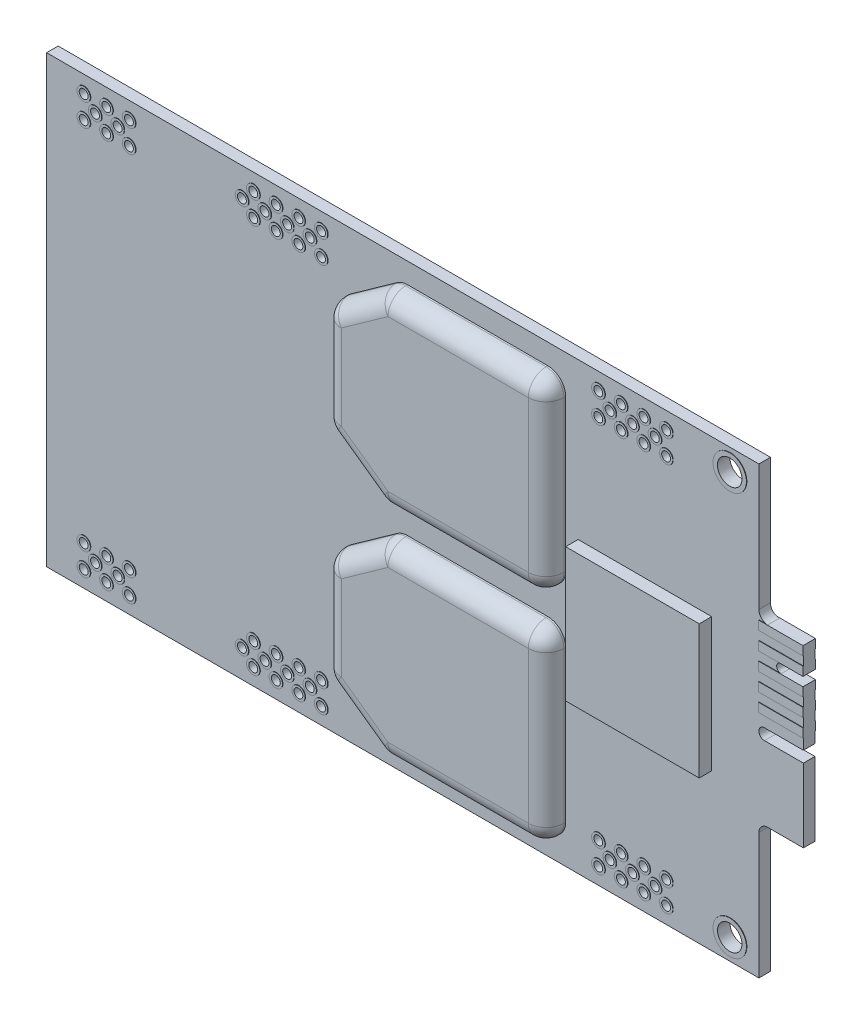
from build123d import *
from build123d.topology import SkipClean

# Parameters (mm, degrees)
SKETCH1_W             = 80
SKETCH1_H             = 50
BOSS_EXTRUDE1_DEPTH   = 1.3
BOSS_EXTRUDE2_DEPTH   = 2.2
BOSS_EXTRUDE2_2_DEPTH = 2.2
FILLET1_R             = 2
FILLET2_R             = 2
SKETCH3_W             = 15
SKETCH3_H             = 15
BOSS_EXTRUDE3_DEPTH   = 1.4
BOSS_EXTRUDE6_DEPTH   = 1.3
SKETCH5_W             = 4
SKETCH5_H             = 4
BOSS_EXTRUDE7_DEPTH   = 1
BOSS_EXTRUDE7_2_DEPTH = 1
BOSS_EXTRUDE7_3_DEPTH = 1
BOSS_EXTRUDE7_4_DEPTH = 1
BOSS_EXTRUDE7_5_DEPTH = 1
SKETCH6_R             = 0.5
CUT_EXTRUDE1_DEPTH    = 11
BOSS_EXTRUDE8_START   = 0.05
SKETCH7_R             = 0.75
SKETCH7_R_2           = 0.5
BOSS_EXTRUDE8_DEPTH   = 0.05
SKETCH8_R             = 0.75
SKETCH8_R_2           = 0.5
BOSS_EXTRUDE9_DEPTH   = 0.05
SKETCH9_W             = 5
SKETCH9_H             = 1
BOSS_EXTRUDE10_DEPTH  = 0.05
SKETCH10_W            = 5
SKETCH10_H            = 1
BOSS_EXTRUDE11_DEPTH  = 0.05
FILLET3_R             = 1
SKETCH12_R            = 1.375
CUT_EXTRUDE2_DEPTH    = 3.556
BOSS_EXTRUDE12_START  = 0.05
SKETCH13_R            = 1.875
SKETCH13_R_2          = 1.375
BOSS_EXTRUDE12_DEPTH  = 0.05
SKETCH14_R            = 1.875
SKETCH14_R_2          = 1.375
BOSS_EXTRUDE13_DEPTH  = 0.05


with BuildPart() as part:
    # Sketch1 → Boss-Extrude1 (new body)
    with BuildSketch(Plane.XY):
        with Locations((40, 25)):
            Rectangle(SKETCH1_W, SKETCH1_H)
    extrude(amount=BOSS_EXTRUDE1_DEPTH)

    # Sketch4 → Boss-Extrude6 (add)
    with BuildSketch(Plane.XY.offset(1.3)):
        with BuildLine():
            Line((80, 34.85), (85, 34.85))
            Line((85, 34.85), (85, 31.85))
            Line((85, 31.85), (82.5, 31.85))
            ThreePointArc((82.5, 31.85), (82, 31.35), (82.5, 30.85))
            Line((82.5, 30.85), (85, 30.85))
            Line((85, 30.85), (85, 24.65))
            Line((85, 24.65), (80.625, 24.65))
            ThreePointArc((80.625, 24.65), (80, 24.025), (80.625, 23.4))
            Line((80.625, 23.4), (85, 23.4))
            Line((85, 23.4), (85, 15.15))
            Line((85, 15.15), (80, 15.15))
            Line((80, 15.15), (78.715665538, 15.15))
            Line((78.715665538, 15.15), (78.715665538, 34.85))
            Line((78.715665538, 34.85), (80, 34.85))
        make_face()
    extrude(amount=-BOSS_EXTRUDE6_DEPTH)

    # Sketch6 → Cut-Extrude1 (cut)
    with BuildSketch(Plane.XY.offset(1.3)):
        with Locations((63.282, 46.85)):
            Circle(SKETCH6_R)
        with Locations((65.822, 46.85)):
            Circle(SKETCH6_R)
        with Locations((68.362, 46.85)):
            Circle(SKETCH6_R)
        with Locations((62.012, 48.12)):
            Circle(SKETCH6_R)
        with Locations((64.552, 48.12)):
            Circle(SKETCH6_R)
        with Locations((64.552, 45.58)):
            Circle(SKETCH6_R)
        with Locations((62.012, 45.58)):
            Circle(SKETCH6_R)
        with Locations(Location((67.092, 45.58, 0), (0, 0, 180))):
            Circle(SKETCH6_R)
        with Locations(Location((69.632, 45.58, 0), (0, 0, 180))):
            Circle(SKETCH6_R)
        with Locations(Location((69.632, 48.12, 0), (0, 0, 180))):
            Circle(SKETCH6_R)
        with Locations(Location((67.092, 48.12, 0), (0, 0, 180))):
            Circle(SKETCH6_R)
        with Locations((27.067, 46.85)):
            Circle(SKETCH6_R)
        with Locations((29.607, 46.85)):
            Circle(SKETCH6_R)
        with Locations((24.527, 46.85)):
            Circle(SKETCH6_R)
        with Locations((28.337, 45.58)):
            Circle(SKETCH6_R)
        with Locations((25.797, 45.58)):
            Circle(SKETCH6_R)
        with Locations((25.797, 48.12)):
            Circle(SKETCH6_R)
        with Locations((28.337, 48.12)):
            Circle(SKETCH6_R)
        with Locations((5.487, 46.85)):
            Circle(SKETCH6_R)
        with Locations((8.027, 46.85)):
            Circle(SKETCH6_R)
        with Locations((6.757, 45.58)):
            Circle(SKETCH6_R)
        with Locations((4.217, 45.58)):
            Circle(SKETCH6_R)
        with Locations((4.217, 48.12)):
            Circle(SKETCH6_R)
        with Locations((6.757, 48.12)):
            Circle(SKETCH6_R)
        with Locations(Location((9.297, 45.58, 0), (0, 0, 180))):
            Circle(SKETCH6_R)
        with Locations(Location((9.297, 48.12, 0), (0, 0, 180))):
            Circle(SKETCH6_R)
        with Locations(Location((63.282, 3.15, 0), (0, 0, 180))):
            Circle(SKETCH6_R)
        with Locations(Location((62.012, 1.88, 0), (0, 0, 180))):
            Circle(SKETCH6_R)
        with Locations(Location((64.552, 1.88, 0), (0, 0, 180))):
            Circle(SKETCH6_R)
        with Locations(Location((65.822, 3.15, 0), (0, 0, 180))):
            Circle(SKETCH6_R)
        with Locations((67.092, 1.88)):
            Circle(SKETCH6_R)
        with Locations((69.632, 1.88)):
            Circle(SKETCH6_R)
        with Locations(Location((68.362, 3.15, 0), (0, 0, 180))):
            Circle(SKETCH6_R)
        with Locations((69.632, 4.42)):
            Circle(SKETCH6_R)
        with Locations((67.092, 4.42)):
            Circle(SKETCH6_R)
        with Locations(Location((64.552, 4.42, 0), (0, 0, 180))):
            Circle(SKETCH6_R)
        with Locations(Location((62.012, 4.42, 0), (0, 0, 180))):
            Circle(SKETCH6_R)
        with Locations(Location((25.797, 4.42, 0), (0, 0, 180))):
            Circle(SKETCH6_R)
        with Locations(Location((28.337, 4.42, 0), (0, 0, 180))):
            Circle(SKETCH6_R)
        with Locations(Location((29.607, 3.15, 0), (0, 0, 180))):
            Circle(SKETCH6_R)
        with Locations(Location((27.067, 3.15, 0), (0, 0, 180))):
            Circle(SKETCH6_R)
        with Locations(Location((28.337, 1.88, 0), (0, 0, 180))):
            Circle(SKETCH6_R)
        with Locations(Location((25.797, 1.88, 0), (0, 0, 180))):
            Circle(SKETCH6_R)
        with Locations(Location((24.527, 3.15, 0), (0, 0, 180))):
            Circle(SKETCH6_R)
        with Locations((9.297, 4.42)):
            Circle(SKETCH6_R)
        with Locations((9.297, 1.88)):
            Circle(SKETCH6_R)
        with Locations(Location((6.757, 1.88, 0), (0, 0, 180))):
            Circle(SKETCH6_R)
        with Locations(Location((8.027, 3.15, 0), (0, 0, 180))):
            Circle(SKETCH6_R)
        with Locations(Location((6.757, 4.42, 0), (0, 0, 180))):
            Circle(SKETCH6_R)
        with Locations(Location((5.487, 3.15, 0), (0, 0, 180))):
            Circle(SKETCH6_R)
        with Locations(Location((4.217, 1.88, 0), (0, 0, 180))):
            Circle(SKETCH6_R)
        with Locations(Location((4.217, 4.42, 0), (0, 0, 180))):
            Circle(SKETCH6_R)
        with Locations(Location((30.877, 45.58, 0), (0, 0, 180))):
            Circle(SKETCH6_R)
        with Locations(Location((30.877, 48.12, 0), (0, 0, 180))):
            Circle(SKETCH6_R)
        with Locations(Location((23.257, 45.58, 0), (0, 0, 180))):
            Circle(SKETCH6_R)
        with Locations(Location((23.257, 48.12, 0), (0, 0, 180))):
            Circle(SKETCH6_R)
        with Locations((21.987, 46.85)):
            Circle(SKETCH6_R)
        with Locations((30.877, 1.88)):
            Circle(SKETCH6_R)
        with Locations((30.877, 4.42)):
            Circle(SKETCH6_R)
        with Locations((23.257, 1.88)):
            Circle(SKETCH6_R)
        with Locations(Location((21.987, 3.15, 0), (0, 0, 180))):
            Circle(SKETCH6_R)
        with Locations((23.257, 4.42)):
            Circle(SKETCH6_R)
    extrude(amount=-CUT_EXTRUDE1_DEPTH, mode=Mode.SUBTRACT)

    # Sketch7 → Boss-Extrude8 (add)
    # profile 1 of 62: a face of its own
    with BuildSketch(Plane.XY.offset(1.3).offset(BOSS_EXTRUDE8_START)):
        with Locations(Location((5.487, 46.85, 0), (0, 0, 180))):
            Circle(SKETCH7_R)
        with Locations((5.487, 46.85)):
            Circle(SKETCH7_R_2, mode=Mode.SUBTRACT)
    # profile 2 of 62: a face of its own
    with BuildSketch(Plane.XY.offset(1.3).offset(BOSS_EXTRUDE8_START)):
        with Locations(Location((8.027, 46.85, 0), (0, 0, 180))):
            Circle(SKETCH7_R)
        with Locations((8.027, 46.85)):
            Circle(SKETCH7_R_2, mode=Mode.SUBTRACT)
    # profile 3 of 62: a face of its own
    with BuildSketch(Plane.XY.offset(1.3).offset(BOSS_EXTRUDE8_START)):
        with Locations(Location((6.757, 45.58, 0), (0, 0, 180))):
            Circle(SKETCH7_R)
        with Locations((6.757, 45.58)):
            Circle(SKETCH7_R_2, mode=Mode.SUBTRACT)
    # profile 4 of 62: a face of its own
    with BuildSketch(Plane.XY.offset(1.3).offset(BOSS_EXTRUDE8_START)):
        with Locations(Location((9.297, 45.58, 0), (0, 0, 180))):
            Circle(SKETCH7_R)
        with Locations((9.297, 45.58)):
            Circle(SKETCH7_R_2, mode=Mode.SUBTRACT)
    # profile 5 of 62: a face of its own
    with BuildSketch(Plane.XY.offset(1.3).offset(BOSS_EXTRUDE8_START)):
        with Locations(Location((25.797, 48.12, 0), (0, 0, 180))):
            Circle(SKETCH7_R)
        with Locations((25.797, 48.12)):
            Circle(SKETCH7_R_2, mode=Mode.SUBTRACT)
    # profile 6 of 62: a face of its own
    with BuildSketch(Plane.XY.offset(1.3).offset(BOSS_EXTRUDE8_START)):
        with Locations(Location((24.527, 46.85, 0), (0, 0, 180))):
            Circle(SKETCH7_R)
        with Locations((24.527, 46.85)):
            Circle(SKETCH7_R_2, mode=Mode.SUBTRACT)
    # profile 7 of 62: a face of its own
    with BuildSketch(Plane.XY.offset(1.3).offset(BOSS_EXTRUDE8_START)):
        with Locations(Location((27.067, 46.85, 0), (0, 0, 180))):
            Circle(SKETCH7_R)
        with Locations((27.067, 46.85)):
            Circle(SKETCH7_R_2, mode=Mode.SUBTRACT)
    # profile 8 of 62: a face of its own
    with BuildSketch(Plane.XY.offset(1.3).offset(BOSS_EXTRUDE8_START)):
        with Locations(Location((28.337, 48.12, 0), (0, 0, 180))):
            Circle(SKETCH7_R)
        with Locations((28.337, 48.12)):
            Circle(SKETCH7_R_2, mode=Mode.SUBTRACT)
    # profile 9 of 62: a face of its own
    with BuildSketch(Plane.XY.offset(1.3).offset(BOSS_EXTRUDE8_START)):
        with Locations(Location((29.607, 46.85, 0), (0, 0, 180))):
            Circle(SKETCH7_R)
        with Locations((29.607, 46.85)):
            Circle(SKETCH7_R_2, mode=Mode.SUBTRACT)
    # profile 10 of 62: a face of its own
    with BuildSketch(Plane.XY.offset(1.3).offset(BOSS_EXTRUDE8_START)):
        with Locations(Location((25.797, 45.58, 0), (0, 0, 180))):
            Circle(SKETCH7_R)
        with Locations((25.797, 45.58)):
            Circle(SKETCH7_R_2, mode=Mode.SUBTRACT)
    # profile 11 of 62: a face of its own
    with BuildSketch(Plane.XY.offset(1.3).offset(BOSS_EXTRUDE8_START)):
        with Locations(Location((28.337, 45.58, 0), (0, 0, 180))):
            Circle(SKETCH7_R)
        with Locations((28.337, 45.58)):
            Circle(SKETCH7_R_2, mode=Mode.SUBTRACT)
    # profile 12 of 62: a face of its own
    with BuildSketch(Plane.XY.offset(1.3).offset(BOSS_EXTRUDE8_START)):
        with Locations(Location((62.012, 48.12, 0), (0, 0, 180))):
            Circle(SKETCH7_R)
        with Locations((62.012, 48.12)):
            Circle(SKETCH7_R_2, mode=Mode.SUBTRACT)
    # profile 13 of 62: a face of its own
    with BuildSketch(Plane.XY.offset(1.3).offset(BOSS_EXTRUDE8_START)):
        with Locations(Location((64.552, 48.12, 0), (0, 0, 180))):
            Circle(SKETCH7_R)
        with Locations((64.552, 48.12)):
            Circle(SKETCH7_R_2, mode=Mode.SUBTRACT)
    # profile 14 of 62: a face of its own
    with BuildSketch(Plane.XY.offset(1.3).offset(BOSS_EXTRUDE8_START)):
        with Locations(Location((67.092, 48.12, 0), (0, 0, 180))):
            Circle(SKETCH7_R)
        with Locations((67.092, 48.12)):
            Circle(SKETCH7_R_2, mode=Mode.SUBTRACT)
    # profile 15 of 62: a face of its own
    with BuildSketch(Plane.XY.offset(1.3).offset(BOSS_EXTRUDE8_START)):
        with Locations(Location((69.632, 48.12, 0), (0, 0, 180))):
            Circle(SKETCH7_R)
        with Locations((69.632, 48.12)):
            Circle(SKETCH7_R_2, mode=Mode.SUBTRACT)
    # profile 16 of 62: a face of its own
    with BuildSketch(Plane.XY.offset(1.3).offset(BOSS_EXTRUDE8_START)):
        with Locations(Location((62.012, 45.58, 0), (0, 0, 180))):
            Circle(SKETCH7_R)
        with Locations((62.012, 45.58)):
            Circle(SKETCH7_R_2, mode=Mode.SUBTRACT)
    # profile 17 of 62: a face of its own
    with BuildSketch(Plane.XY.offset(1.3).offset(BOSS_EXTRUDE8_START)):
        with Locations(Location((4.217, 48.12, 0), (0, 0, 180))):
            Circle(SKETCH7_R)
        with Locations((4.217, 48.12)):
            Circle(SKETCH7_R_2, mode=Mode.SUBTRACT)
    # profile 18 of 62: a face of its own
    with BuildSketch(Plane.XY.offset(1.3).offset(BOSS_EXTRUDE8_START)):
        with Locations(Location((6.757, 48.12, 0), (0, 0, 180))):
            Circle(SKETCH7_R)
        with Locations((6.757, 48.12)):
            Circle(SKETCH7_R_2, mode=Mode.SUBTRACT)
    # profile 19 of 62: a face of its own
    with BuildSketch(Plane.XY.offset(1.3).offset(BOSS_EXTRUDE8_START)):
        with Locations(Location((63.282, 46.85, 0), (0, 0, 180))):
            Circle(SKETCH7_R)
        with Locations((63.282, 46.85)):
            Circle(SKETCH7_R_2, mode=Mode.SUBTRACT)
    # profile 20 of 62: a face of its own
    with BuildSketch(Plane.XY.offset(1.3).offset(BOSS_EXTRUDE8_START)):
        with Locations(Location((9.297, 48.12, 0), (0, 0, 180))):
            Circle(SKETCH7_R)
        with Locations((9.297, 48.12)):
            Circle(SKETCH7_R_2, mode=Mode.SUBTRACT)
    # profile 21 of 62: a face of its own
    with BuildSketch(Plane.XY.offset(1.3).offset(BOSS_EXTRUDE8_START)):
        with Locations(Location((4.217, 45.58, 0), (0, 0, 180))):
            Circle(SKETCH7_R)
        with Locations((4.217, 45.58)):
            Circle(SKETCH7_R_2, mode=Mode.SUBTRACT)
    # profile 22 of 62: a face of its own
    with BuildSketch(Plane.XY.offset(1.3).offset(BOSS_EXTRUDE8_START)):
        with Locations(Location((65.822, 46.85, 0), (0, 0, 180))):
            Circle(SKETCH7_R)
        with Locations((65.822, 46.85)):
            Circle(SKETCH7_R_2, mode=Mode.SUBTRACT)
    # profile 23 of 62: a face of its own
    with BuildSketch(Plane.XY.offset(1.3).offset(BOSS_EXTRUDE8_START)):
        with Locations(Location((68.362, 46.85, 0), (0, 0, 180))):
            Circle(SKETCH7_R)
        with Locations((68.362, 46.85)):
            Circle(SKETCH7_R_2, mode=Mode.SUBTRACT)
    # profile 24 of 62: a face of its own
    with BuildSketch(Plane.XY.offset(1.3).offset(BOSS_EXTRUDE8_START)):
        with Locations(Location((69.632, 45.58, 0), (0, 0, 180))):
            Circle(SKETCH7_R)
        with Locations((69.632, 45.58)):
            Circle(SKETCH7_R_2, mode=Mode.SUBTRACT)
    # profile 25 of 62: a face of its own
    with BuildSketch(Plane.XY.offset(1.3).offset(BOSS_EXTRUDE8_START)):
        with Locations(Location((67.092, 45.58, 0), (0, 0, 180))):
            Circle(SKETCH7_R)
        with Locations((67.092, 45.58)):
            Circle(SKETCH7_R_2, mode=Mode.SUBTRACT)
    # profile 26 of 62: a face of its own
    with BuildSketch(Plane.XY.offset(1.3).offset(BOSS_EXTRUDE8_START)):
        with Locations(Location((64.552, 45.58, 0), (0, 0, 180))):
            Circle(SKETCH7_R)
        with Locations((64.552, 45.58)):
            Circle(SKETCH7_R_2, mode=Mode.SUBTRACT)
    # profile 27 of 62: a face of its own
    with BuildSketch(Plane.XY.offset(1.3).offset(BOSS_EXTRUDE8_START)):
        with Locations(Location((69.632, 4.42, 0), (0, 0, 180))):
            Circle(SKETCH7_R)
        with Locations((69.632, 4.42)):
            Circle(SKETCH7_R_2, mode=Mode.SUBTRACT)
    # profile 28 of 62: a face of its own
    with BuildSketch(Plane.XY.offset(1.3).offset(BOSS_EXTRUDE8_START)):
        with Locations(Location((67.092, 4.42, 0), (0, 0, 180))):
            Circle(SKETCH7_R)
        with Locations((67.092, 4.42)):
            Circle(SKETCH7_R_2, mode=Mode.SUBTRACT)
    # profile 29 of 62: a face of its own
    with BuildSketch(Plane.XY.offset(1.3).offset(BOSS_EXTRUDE8_START)):
        with Locations(Location((64.552, 4.42, 0), (0, 0, 180))):
            Circle(SKETCH7_R)
        with Locations((64.552, 4.42)):
            Circle(SKETCH7_R_2, mode=Mode.SUBTRACT)
    # profile 30 of 62: a face of its own
    with BuildSketch(Plane.XY.offset(1.3).offset(BOSS_EXTRUDE8_START)):
        with Locations(Location((62.012, 4.42, 0), (0, 0, 180))):
            Circle(SKETCH7_R)
        with Locations((62.012, 4.42)):
            Circle(SKETCH7_R_2, mode=Mode.SUBTRACT)
    # profile 31 of 62: a face of its own
    with BuildSketch(Plane.XY.offset(1.3).offset(BOSS_EXTRUDE8_START)):
        with Locations(Location((62.012, 1.88, 0), (0, 0, 180))):
            Circle(SKETCH7_R)
        with Locations((62.012, 1.88)):
            Circle(SKETCH7_R_2, mode=Mode.SUBTRACT)
    # profile 32 of 62: a face of its own
    with BuildSketch(Plane.XY.offset(1.3).offset(BOSS_EXTRUDE8_START)):
        with Locations(Location((63.282, 3.15, 0), (0, 0, 180))):
            Circle(SKETCH7_R)
        with Locations((63.282, 3.15)):
            Circle(SKETCH7_R_2, mode=Mode.SUBTRACT)
    # profile 33 of 62: a face of its own
    with BuildSketch(Plane.XY.offset(1.3).offset(BOSS_EXTRUDE8_START)):
        with Locations(Location((64.552, 1.88, 0), (0, 0, 180))):
            Circle(SKETCH7_R)
        with Locations((64.552, 1.88)):
            Circle(SKETCH7_R_2, mode=Mode.SUBTRACT)
    # profile 34 of 62: a face of its own
    with BuildSketch(Plane.XY.offset(1.3).offset(BOSS_EXTRUDE8_START)):
        with Locations(Location((65.822, 3.15, 0), (0, 0, 180))):
            Circle(SKETCH7_R)
        with Locations((65.822, 3.15)):
            Circle(SKETCH7_R_2, mode=Mode.SUBTRACT)
    # profile 35 of 62: a face of its own
    with BuildSketch(Plane.XY.offset(1.3).offset(BOSS_EXTRUDE8_START)):
        with Locations(Location((67.092, 1.88, 0), (0, 0, 180))):
            Circle(SKETCH7_R)
        with Locations((67.092, 1.88)):
            Circle(SKETCH7_R_2, mode=Mode.SUBTRACT)
    # profile 36 of 62: a face of its own
    with BuildSketch(Plane.XY.offset(1.3).offset(BOSS_EXTRUDE8_START)):
        with Locations(Location((68.362, 3.15, 0), (0, 0, 180))):
            Circle(SKETCH7_R)
        with Locations((68.362, 3.15)):
            Circle(SKETCH7_R_2, mode=Mode.SUBTRACT)
    # profile 37 of 62: a face of its own
    with BuildSketch(Plane.XY.offset(1.3).offset(BOSS_EXTRUDE8_START)):
        with Locations(Location((69.632, 1.88, 0), (0, 0, 180))):
            Circle(SKETCH7_R)
        with Locations((69.632, 1.88)):
            Circle(SKETCH7_R_2, mode=Mode.SUBTRACT)
    # profile 38 of 62: a face of its own
    with BuildSketch(Plane.XY.offset(1.3).offset(BOSS_EXTRUDE8_START)):
        with Locations(Location((29.607, 3.15, 0), (0, 0, 180))):
            Circle(SKETCH7_R)
        with Locations((29.607, 3.15)):
            Circle(SKETCH7_R_2, mode=Mode.SUBTRACT)
    # profile 39 of 62: a face of its own
    with BuildSketch(Plane.XY.offset(1.3).offset(BOSS_EXTRUDE8_START)):
        with Locations(Location((28.337, 4.42, 0), (0, 0, 180))):
            Circle(SKETCH7_R)
        with Locations((28.337, 4.42)):
            Circle(SKETCH7_R_2, mode=Mode.SUBTRACT)
    # profile 40 of 62: a face of its own
    with BuildSketch(Plane.XY.offset(1.3).offset(BOSS_EXTRUDE8_START)):
        with Locations(Location((25.797, 4.42, 0), (0, 0, 180))):
            Circle(SKETCH7_R)
        with Locations((25.797, 4.42)):
            Circle(SKETCH7_R_2, mode=Mode.SUBTRACT)
    # profile 41 of 62: a face of its own
    with BuildSketch(Plane.XY.offset(1.3).offset(BOSS_EXTRUDE8_START)):
        with Locations(Location((24.527, 3.15, 0), (0, 0, 180))):
            Circle(SKETCH7_R)
        with Locations((24.527, 3.15)):
            Circle(SKETCH7_R_2, mode=Mode.SUBTRACT)
    # profile 42 of 62: a face of its own
    with BuildSketch(Plane.XY.offset(1.3).offset(BOSS_EXTRUDE8_START)):
        with Locations(Location((27.067, 3.15, 0), (0, 0, 180))):
            Circle(SKETCH7_R)
        with Locations((27.067, 3.15)):
            Circle(SKETCH7_R_2, mode=Mode.SUBTRACT)
    # profile 43 of 62: a face of its own
    with BuildSketch(Plane.XY.offset(1.3).offset(BOSS_EXTRUDE8_START)):
        with Locations(Location((25.797, 1.88, 0), (0, 0, 180))):
            Circle(SKETCH7_R)
        with Locations((25.797, 1.88)):
            Circle(SKETCH7_R_2, mode=Mode.SUBTRACT)
    # profile 44 of 62: a face of its own
    with BuildSketch(Plane.XY.offset(1.3).offset(BOSS_EXTRUDE8_START)):
        with Locations(Location((28.337, 1.88, 0), (0, 0, 180))):
            Circle(SKETCH7_R)
        with Locations((28.337, 1.88)):
            Circle(SKETCH7_R_2, mode=Mode.SUBTRACT)
    # profile 45 of 62: a face of its own
    with BuildSketch(Plane.XY.offset(1.3).offset(BOSS_EXTRUDE8_START)):
        with Locations(Location((4.217, 4.42, 0), (0, 0, 180))):
            Circle(SKETCH7_R)
        with Locations((4.217, 4.42)):
            Circle(SKETCH7_R_2, mode=Mode.SUBTRACT)
    # profile 46 of 62: a face of its own
    with BuildSketch(Plane.XY.offset(1.3).offset(BOSS_EXTRUDE8_START)):
        with Locations(Location((6.757, 4.42, 0), (0, 0, 180))):
            Circle(SKETCH7_R)
        with Locations((6.757, 4.42)):
            Circle(SKETCH7_R_2, mode=Mode.SUBTRACT)
    # profile 47 of 62: a face of its own
    with BuildSketch(Plane.XY.offset(1.3).offset(BOSS_EXTRUDE8_START)):
        with Locations(Location((9.297, 4.42, 0), (0, 0, 180))):
            Circle(SKETCH7_R)
        with Locations((9.297, 4.42)):
            Circle(SKETCH7_R_2, mode=Mode.SUBTRACT)
    # profile 48 of 62: a face of its own
    with BuildSketch(Plane.XY.offset(1.3).offset(BOSS_EXTRUDE8_START)):
        with Locations(Location((5.487, 3.15, 0), (0, 0, 180))):
            Circle(SKETCH7_R)
        with Locations((5.487, 3.15)):
            Circle(SKETCH7_R_2, mode=Mode.SUBTRACT)
    # profile 49 of 62: a face of its own
    with BuildSketch(Plane.XY.offset(1.3).offset(BOSS_EXTRUDE8_START)):
        with Locations(Location((8.027, 3.15, 0), (0, 0, 180))):
            Circle(SKETCH7_R)
        with Locations((8.027, 3.15)):
            Circle(SKETCH7_R_2, mode=Mode.SUBTRACT)
    # profile 50 of 62: a face of its own
    with BuildSketch(Plane.XY.offset(1.3).offset(BOSS_EXTRUDE8_START)):
        with Locations(Location((4.217, 1.88, 0), (0, 0, 180))):
            Circle(SKETCH7_R)
        with Locations((4.217, 1.88)):
            Circle(SKETCH7_R_2, mode=Mode.SUBTRACT)
    # profile 51 of 62: a face of its own
    with BuildSketch(Plane.XY.offset(1.3).offset(BOSS_EXTRUDE8_START)):
        with Locations(Location((6.757, 1.88, 0), (0, 0, 180))):
            Circle(SKETCH7_R)
        with Locations((6.757, 1.88)):
            Circle(SKETCH7_R_2, mode=Mode.SUBTRACT)
    # profile 52 of 62: a face of its own
    with BuildSketch(Plane.XY.offset(1.3).offset(BOSS_EXTRUDE8_START)):
        with Locations(Location((9.297, 1.88, 0), (0, 0, 180))):
            Circle(SKETCH7_R)
        with Locations((9.297, 1.88)):
            Circle(SKETCH7_R_2, mode=Mode.SUBTRACT)
    # profile 53 of 62: a face of its own
    with BuildSketch(Plane.XY.offset(1.3).offset(BOSS_EXTRUDE8_START)):
        with Locations(Location((23.257, 48.12, 0), (0, 0, 180))):
            Circle(SKETCH7_R)
        with Locations((23.257, 48.12)):
            Circle(SKETCH7_R_2, mode=Mode.SUBTRACT)
    # profile 54 of 62: a face of its own
    with BuildSketch(Plane.XY.offset(1.3).offset(BOSS_EXTRUDE8_START)):
        with Locations(Location((21.987, 46.85, 0), (0, 0, 180))):
            Circle(SKETCH7_R)
        with Locations((21.987, 46.85)):
            Circle(SKETCH7_R_2, mode=Mode.SUBTRACT)
    # profile 55 of 62: a face of its own
    with BuildSketch(Plane.XY.offset(1.3).offset(BOSS_EXTRUDE8_START)):
        with Locations(Location((23.257, 45.58, 0), (0, 0, 180))):
            Circle(SKETCH7_R)
        with Locations((23.257, 45.58)):
            Circle(SKETCH7_R_2, mode=Mode.SUBTRACT)
    # profile 56 of 62: a face of its own
    with BuildSketch(Plane.XY.offset(1.3).offset(BOSS_EXTRUDE8_START)):
        with Locations(Location((30.877, 48.12, 0), (0, 0, 180))):
            Circle(SKETCH7_R)
        with Locations((30.877, 48.12)):
            Circle(SKETCH7_R_2, mode=Mode.SUBTRACT)
    # profile 57 of 62: a face of its own
    with BuildSketch(Plane.XY.offset(1.3).offset(BOSS_EXTRUDE8_START)):
        with Locations(Location((30.877, 45.58, 0), (0, 0, 180))):
            Circle(SKETCH7_R)
        with Locations((30.877, 45.58)):
            Circle(SKETCH7_R_2, mode=Mode.SUBTRACT)
    # profile 58 of 62: a face of its own
    with BuildSketch(Plane.XY.offset(1.3).offset(BOSS_EXTRUDE8_START)):
        with Locations(Location((23.257, 4.42, 0), (0, 0, 180))):
            Circle(SKETCH7_R)
        with Locations((23.257, 4.42)):
            Circle(SKETCH7_R_2, mode=Mode.SUBTRACT)
    # profile 59 of 62: a face of its own
    with BuildSketch(Plane.XY.offset(1.3).offset(BOSS_EXTRUDE8_START)):
        with Locations(Location((21.987, 3.15, 0), (0, 0, 180))):
            Circle(SKETCH7_R)
        with Locations((21.987, 3.15)):
            Circle(SKETCH7_R_2, mode=Mode.SUBTRACT)
    # profile 60 of 62: a face of its own
    with BuildSketch(Plane.XY.offset(1.3).offset(BOSS_EXTRUDE8_START)):
        with Locations(Location((23.257, 1.88, 0), (0, 0, 180))):
            Circle(SKETCH7_R)
        with Locations((23.257, 1.88)):
            Circle(SKETCH7_R_2, mode=Mode.SUBTRACT)
    # profile 61 of 62: a face of its own
    with BuildSketch(Plane.XY.offset(1.3).offset(BOSS_EXTRUDE8_START)):
        with Locations(Location((30.877, 4.42, 0), (0, 0, 180))):
            Circle(SKETCH7_R)
        with Locations((30.877, 4.42)):
            Circle(SKETCH7_R_2, mode=Mode.SUBTRACT)
    # profile 62 of 62: a face of its own
    with BuildSketch(Plane.XY.offset(1.3).offset(BOSS_EXTRUDE8_START)):
        with Locations(Location((30.877, 1.88, 0), (0, 0, 180))):
            Circle(SKETCH7_R)
        with Locations((30.877, 1.88)):
            Circle(SKETCH7_R_2, mode=Mode.SUBTRACT)
    extrude(amount=-BOSS_EXTRUDE8_DEPTH)

    # Sketch8 → Boss-Extrude9 (add)
    # profile 1 of 62: a face of its own
    with SkipClean():  # the faces are left unmerged after this step: merging them gives an invalid solid
        with BuildSketch(Plane(origin=(0, 0, 0), x_dir=(-1, 0, 0), z_dir=(0, 0, -1))):
            with Locations((-9.297, 48.12)):
                Circle(SKETCH8_R)
            with Locations(Location((-9.297, 48.12, 0), (0, 0, 180))):
                Circle(SKETCH8_R_2, mode=Mode.SUBTRACT)
        # profile 2 of 62: a face of its own
        with BuildSketch(Plane(origin=(0, 0, 0), x_dir=(-1, 0, 0), z_dir=(0, 0, -1))):
            with Locations((-6.757, 48.12)):
                Circle(SKETCH8_R)
            with Locations(Location((-6.757, 48.12, 0), (0, 0, 180))):
                Circle(SKETCH8_R_2, mode=Mode.SUBTRACT)
        # profile 3 of 62: a face of its own
        with BuildSketch(Plane(origin=(0, 0, 0), x_dir=(-1, 0, 0), z_dir=(0, 0, -1))):
            with Locations((-5.487, 46.85)):
                Circle(SKETCH8_R)
            with Locations(Location((-5.487, 46.85, 0), (0, 0, 180))):
                Circle(SKETCH8_R_2, mode=Mode.SUBTRACT)
        # profile 4 of 62: a face of its own
        with BuildSketch(Plane(origin=(0, 0, 0), x_dir=(-1, 0, 0), z_dir=(0, 0, -1))):
            with Locations((-4.217, 45.58)):
                Circle(SKETCH8_R)
            with Locations(Location((-4.217, 45.58, 0), (0, 0, 180))):
                Circle(SKETCH8_R_2, mode=Mode.SUBTRACT)
        # profile 5 of 62: a face of its own
        with BuildSketch(Plane(origin=(0, 0, 0), x_dir=(-1, 0, 0), z_dir=(0, 0, -1))):
            with Locations((-24.527, 46.85)):
                Circle(SKETCH8_R)
            with Locations(Location((-24.527, 46.85, 0), (0, 0, 180))):
                Circle(SKETCH8_R_2, mode=Mode.SUBTRACT)
        # profile 6 of 62: a face of its own
        with BuildSketch(Plane(origin=(0, 0, 0), x_dir=(-1, 0, 0), z_dir=(0, 0, -1))):
            with Locations((-25.797, 48.12)):
                Circle(SKETCH8_R)
            with Locations(Location((-25.797, 48.12, 0), (0, 0, 180))):
                Circle(SKETCH8_R_2, mode=Mode.SUBTRACT)
        # profile 7 of 62: a face of its own
        with BuildSketch(Plane(origin=(0, 0, 0), x_dir=(-1, 0, 0), z_dir=(0, 0, -1))):
            with Locations((-9.297, 45.58)):
                Circle(SKETCH8_R)
            with Locations(Location((-9.297, 45.58, 0), (0, 0, 180))):
                Circle(SKETCH8_R_2, mode=Mode.SUBTRACT)
        # profile 8 of 62: a face of its own
        with BuildSketch(Plane(origin=(0, 0, 0), x_dir=(-1, 0, 0), z_dir=(0, 0, -1))):
            with Locations((-6.757, 45.58)):
                Circle(SKETCH8_R)
            with Locations(Location((-6.757, 45.58, 0), (0, 0, 180))):
                Circle(SKETCH8_R_2, mode=Mode.SUBTRACT)
        # profile 9 of 62: a face of its own
        with BuildSketch(Plane(origin=(0, 0, 0), x_dir=(-1, 0, 0), z_dir=(0, 0, -1))):
            with Locations((-8.027, 46.85)):
                Circle(SKETCH8_R)
            with Locations(Location((-8.027, 46.85, 0), (0, 0, 180))):
                Circle(SKETCH8_R_2, mode=Mode.SUBTRACT)
        # profile 10 of 62: a face of its own
        with BuildSketch(Plane(origin=(0, 0, 0), x_dir=(-1, 0, 0), z_dir=(0, 0, -1))):
            with Locations((-28.337, 45.58)):
                Circle(SKETCH8_R)
            with Locations(Location((-28.337, 45.58, 0), (0, 0, 180))):
                Circle(SKETCH8_R_2, mode=Mode.SUBTRACT)
        # profile 11 of 62: a face of its own
        with BuildSketch(Plane(origin=(0, 0, 0), x_dir=(-1, 0, 0), z_dir=(0, 0, -1))):
            with Locations((-25.797, 45.58)):
                Circle(SKETCH8_R)
            with Locations(Location((-25.797, 45.58, 0), (0, 0, 180))):
                Circle(SKETCH8_R_2, mode=Mode.SUBTRACT)
        # profile 12 of 62: a face of its own
        with BuildSketch(Plane(origin=(0, 0, 0), x_dir=(-1, 0, 0), z_dir=(0, 0, -1))):
            with Locations((-29.607, 46.85)):
                Circle(SKETCH8_R)
            with Locations(Location((-29.607, 46.85, 0), (0, 0, 180))):
                Circle(SKETCH8_R_2, mode=Mode.SUBTRACT)
        # profile 13 of 62: a face of its own
        with BuildSketch(Plane(origin=(0, 0, 0), x_dir=(-1, 0, 0), z_dir=(0, 0, -1))):
            with Locations((-28.337, 48.12)):
                Circle(SKETCH8_R)
            with Locations(Location((-28.337, 48.12, 0), (0, 0, 180))):
                Circle(SKETCH8_R_2, mode=Mode.SUBTRACT)
        # profile 14 of 62: a face of its own
        with BuildSketch(Plane(origin=(0, 0, 0), x_dir=(-1, 0, 0), z_dir=(0, 0, -1))):
            with Locations((-27.067, 46.85)):
                Circle(SKETCH8_R)
            with Locations(Location((-27.067, 46.85, 0), (0, 0, 180))):
                Circle(SKETCH8_R_2, mode=Mode.SUBTRACT)
        # profile 15 of 62: a face of its own
        with BuildSketch(Plane(origin=(0, 0, 0), x_dir=(-1, 0, 0), z_dir=(0, 0, -1))):
            with Locations((-63.282, 46.85)):
                Circle(SKETCH8_R)
            with Locations(Location((-63.282, 46.85, 0), (0, 0, 180))):
                Circle(SKETCH8_R_2, mode=Mode.SUBTRACT)
        # profile 16 of 62: a face of its own
        with BuildSketch(Plane(origin=(0, 0, 0), x_dir=(-1, 0, 0), z_dir=(0, 0, -1))):
            with Locations((-62.012, 45.58)):
                Circle(SKETCH8_R)
            with Locations(Location((-62.012, 45.58, 0), (0, 0, 180))):
                Circle(SKETCH8_R_2, mode=Mode.SUBTRACT)
        # profile 17 of 62: a face of its own
        with BuildSketch(Plane(origin=(0, 0, 0), x_dir=(-1, 0, 0), z_dir=(0, 0, -1))):
            with Locations((-69.632, 48.12)):
                Circle(SKETCH8_R)
            with Locations(Location((-69.632, 48.12, 0), (0, 0, 180))):
                Circle(SKETCH8_R_2, mode=Mode.SUBTRACT)
        # profile 18 of 62: a face of its own
        with BuildSketch(Plane(origin=(0, 0, 0), x_dir=(-1, 0, 0), z_dir=(0, 0, -1))):
            with Locations((-67.092, 48.12)):
                Circle(SKETCH8_R)
            with Locations(Location((-67.092, 48.12, 0), (0, 0, 180))):
                Circle(SKETCH8_R_2, mode=Mode.SUBTRACT)
        # profile 19 of 62: a face of its own
        with BuildSketch(Plane(origin=(0, 0, 0), x_dir=(-1, 0, 0), z_dir=(0, 0, -1))):
            with Locations((-64.552, 48.12)):
                Circle(SKETCH8_R)
            with Locations(Location((-64.552, 48.12, 0), (0, 0, 180))):
                Circle(SKETCH8_R_2, mode=Mode.SUBTRACT)
        # profile 20 of 62: a face of its own
        with BuildSketch(Plane(origin=(0, 0, 0), x_dir=(-1, 0, 0), z_dir=(0, 0, -1))):
            with Locations((-62.012, 48.12)):
                Circle(SKETCH8_R)
            with Locations(Location((-62.012, 48.12, 0), (0, 0, 180))):
                Circle(SKETCH8_R_2, mode=Mode.SUBTRACT)
        # profile 21 of 62: a face of its own
        with BuildSketch(Plane(origin=(0, 0, 0), x_dir=(-1, 0, 0), z_dir=(0, 0, -1))):
            with Locations((-64.552, 45.58)):
                Circle(SKETCH8_R)
            with Locations(Location((-64.552, 45.58, 0), (0, 0, 180))):
                Circle(SKETCH8_R_2, mode=Mode.SUBTRACT)
        # profile 22 of 62: a face of its own
        with BuildSketch(Plane(origin=(0, 0, 0), x_dir=(-1, 0, 0), z_dir=(0, 0, -1))):
            with Locations((-67.092, 45.58)):
                Circle(SKETCH8_R)
            with Locations(Location((-67.092, 45.58, 0), (0, 0, 180))):
                Circle(SKETCH8_R_2, mode=Mode.SUBTRACT)
        # profile 23 of 62: a face of its own
        with BuildSketch(Plane(origin=(0, 0, 0), x_dir=(-1, 0, 0), z_dir=(0, 0, -1))):
            with Locations((-69.632, 45.58)):
                Circle(SKETCH8_R)
            with Locations(Location((-69.632, 45.58, 0), (0, 0, 180))):
                Circle(SKETCH8_R_2, mode=Mode.SUBTRACT)
        # profile 24 of 62: a face of its own
        with BuildSketch(Plane(origin=(0, 0, 0), x_dir=(-1, 0, 0), z_dir=(0, 0, -1))):
            with Locations((-68.362, 46.85)):
                Circle(SKETCH8_R)
            with Locations(Location((-68.362, 46.85, 0), (0, 0, 180))):
                Circle(SKETCH8_R_2, mode=Mode.SUBTRACT)
        # profile 25 of 62: a face of its own
        with BuildSketch(Plane(origin=(0, 0, 0), x_dir=(-1, 0, 0), z_dir=(0, 0, -1))):
            with Locations((-65.822, 46.85)):
                Circle(SKETCH8_R)
            with Locations(Location((-65.822, 46.85, 0), (0, 0, 180))):
                Circle(SKETCH8_R_2, mode=Mode.SUBTRACT)
        # profile 26 of 62: a face of its own
        with BuildSketch(Plane(origin=(0, 0, 0), x_dir=(-1, 0, 0), z_dir=(0, 0, -1))):
            with Locations((-62.012, 1.88)):
                Circle(SKETCH8_R)
            with Locations(Location((-62.012, 1.88, 0), (0, 0, 180))):
                Circle(SKETCH8_R_2, mode=Mode.SUBTRACT)
        # profile 27 of 62: a face of its own
        with BuildSketch(Plane(origin=(0, 0, 0), x_dir=(-1, 0, 0), z_dir=(0, 0, -1))):
            with Locations((-62.012, 4.42)):
                Circle(SKETCH8_R)
            with Locations(Location((-62.012, 4.42, 0), (0, 0, 180))):
                Circle(SKETCH8_R_2, mode=Mode.SUBTRACT)
        # profile 28 of 62: a face of its own
        with BuildSketch(Plane(origin=(0, 0, 0), x_dir=(-1, 0, 0), z_dir=(0, 0, -1))):
            with Locations((-64.552, 4.42)):
                Circle(SKETCH8_R)
            with Locations(Location((-64.552, 4.42, 0), (0, 0, 180))):
                Circle(SKETCH8_R_2, mode=Mode.SUBTRACT)
        # profile 29 of 62: a face of its own
        with BuildSketch(Plane(origin=(0, 0, 0), x_dir=(-1, 0, 0), z_dir=(0, 0, -1))):
            with Locations((-67.092, 4.42)):
                Circle(SKETCH8_R)
            with Locations(Location((-67.092, 4.42, 0), (0, 0, 180))):
                Circle(SKETCH8_R_2, mode=Mode.SUBTRACT)
        # profile 30 of 62: a face of its own
        with BuildSketch(Plane(origin=(0, 0, 0), x_dir=(-1, 0, 0), z_dir=(0, 0, -1))):
            with Locations((-69.632, 4.42)):
                Circle(SKETCH8_R)
            with Locations(Location((-69.632, 4.42, 0), (0, 0, 180))):
                Circle(SKETCH8_R_2, mode=Mode.SUBTRACT)
        # profile 31 of 62: a face of its own
        with BuildSketch(Plane(origin=(0, 0, 0), x_dir=(-1, 0, 0), z_dir=(0, 0, -1))):
            with Locations((-69.632, 1.88)):
                Circle(SKETCH8_R)
            with Locations(Location((-69.632, 1.88, 0), (0, 0, 180))):
                Circle(SKETCH8_R_2, mode=Mode.SUBTRACT)
        # profile 32 of 62: a face of its own
        with BuildSketch(Plane(origin=(0, 0, 0), x_dir=(-1, 0, 0), z_dir=(0, 0, -1))):
            with Locations((-68.362, 3.15)):
                Circle(SKETCH8_R)
            with Locations(Location((-68.362, 3.15, 0), (0, 0, 180))):
                Circle(SKETCH8_R_2, mode=Mode.SUBTRACT)
        # profile 33 of 62: a face of its own
        with BuildSketch(Plane(origin=(0, 0, 0), x_dir=(-1, 0, 0), z_dir=(0, 0, -1))):
            with Locations((-67.092, 1.88)):
                Circle(SKETCH8_R)
            with Locations(Location((-67.092, 1.88, 0), (0, 0, 180))):
                Circle(SKETCH8_R_2, mode=Mode.SUBTRACT)
        # profile 34 of 62: a face of its own
        with BuildSketch(Plane(origin=(0, 0, 0), x_dir=(-1, 0, 0), z_dir=(0, 0, -1))):
            with Locations((-65.822, 3.15)):
                Circle(SKETCH8_R)
            with Locations(Location((-65.822, 3.15, 0), (0, 0, 180))):
                Circle(SKETCH8_R_2, mode=Mode.SUBTRACT)
        # profile 35 of 62: a face of its own
        with BuildSketch(Plane(origin=(0, 0, 0), x_dir=(-1, 0, 0), z_dir=(0, 0, -1))):
            with Locations((-64.552, 1.88)):
                Circle(SKETCH8_R)
            with Locations(Location((-64.552, 1.88, 0), (0, 0, 180))):
                Circle(SKETCH8_R_2, mode=Mode.SUBTRACT)
        # profile 36 of 62: a face of its own
        with BuildSketch(Plane(origin=(0, 0, 0), x_dir=(-1, 0, 0), z_dir=(0, 0, -1))):
            with Locations((-63.282, 3.15)):
                Circle(SKETCH8_R)
            with Locations(Location((-63.282, 3.15, 0), (0, 0, 180))):
                Circle(SKETCH8_R_2, mode=Mode.SUBTRACT)
        # profile 37 of 62: a face of its own
        with BuildSketch(Plane(origin=(0, 0, 0), x_dir=(-1, 0, 0), z_dir=(0, 0, -1))):
            with Locations((-24.527, 3.15)):
                Circle(SKETCH8_R)
            with Locations(Location((-24.527, 3.15, 0), (0, 0, 180))):
                Circle(SKETCH8_R_2, mode=Mode.SUBTRACT)
        # profile 38 of 62: a face of its own
        with BuildSketch(Plane(origin=(0, 0, 0), x_dir=(-1, 0, 0), z_dir=(0, 0, -1))):
            with Locations((-25.797, 4.42)):
                Circle(SKETCH8_R)
            with Locations(Location((-25.797, 4.42, 0), (0, 0, 180))):
                Circle(SKETCH8_R_2, mode=Mode.SUBTRACT)
        # profile 39 of 62: a face of its own
        with BuildSketch(Plane(origin=(0, 0, 0), x_dir=(-1, 0, 0), z_dir=(0, 0, -1))):
            with Locations((-28.337, 4.42)):
                Circle(SKETCH8_R)
            with Locations(Location((-28.337, 4.42, 0), (0, 0, 180))):
                Circle(SKETCH8_R_2, mode=Mode.SUBTRACT)
        # profile 40 of 62: a face of its own
        with BuildSketch(Plane(origin=(0, 0, 0), x_dir=(-1, 0, 0), z_dir=(0, 0, -1))):
            with Locations((-29.607, 3.15)):
                Circle(SKETCH8_R)
            with Locations(Location((-29.607, 3.15, 0), (0, 0, 180))):
                Circle(SKETCH8_R_2, mode=Mode.SUBTRACT)
        # profile 41 of 62: a face of its own
        with BuildSketch(Plane(origin=(0, 0, 0), x_dir=(-1, 0, 0), z_dir=(0, 0, -1))):
            with Locations((-4.217, 48.12)):
                Circle(SKETCH8_R)
            with Locations(Location((-4.217, 48.12, 0), (0, 0, 180))):
                Circle(SKETCH8_R_2, mode=Mode.SUBTRACT)
        # profile 42 of 62: a face of its own
        with BuildSketch(Plane(origin=(0, 0, 0), x_dir=(-1, 0, 0), z_dir=(0, 0, -1))):
            with Locations((-6.757, 4.42)):
                Circle(SKETCH8_R)
            with Locations(Location((-6.757, 4.42, 0), (0, 0, 180))):
                Circle(SKETCH8_R_2, mode=Mode.SUBTRACT)
        # profile 43 of 62: a face of its own
        with BuildSketch(Plane(origin=(0, 0, 0), x_dir=(-1, 0, 0), z_dir=(0, 0, -1))):
            with Locations((-4.217, 4.42)):
                Circle(SKETCH8_R)
            with Locations(Location((-4.217, 4.42, 0), (0, 0, 180))):
                Circle(SKETCH8_R_2, mode=Mode.SUBTRACT)
        # profile 44 of 62: a face of its own
        with BuildSketch(Plane(origin=(0, 0, 0), x_dir=(-1, 0, 0), z_dir=(0, 0, -1))):
            with Locations((-28.337, 1.88)):
                Circle(SKETCH8_R)
            with Locations(Location((-28.337, 1.88, 0), (0, 0, 180))):
                Circle(SKETCH8_R_2, mode=Mode.SUBTRACT)
        # profile 45 of 62: a face of its own
        with BuildSketch(Plane(origin=(0, 0, 0), x_dir=(-1, 0, 0), z_dir=(0, 0, -1))):
            with Locations((-25.797, 1.88)):
                Circle(SKETCH8_R)
            with Locations(Location((-25.797, 1.88, 0), (0, 0, 180))):
                Circle(SKETCH8_R_2, mode=Mode.SUBTRACT)
        # profile 46 of 62: a face of its own
        with BuildSketch(Plane(origin=(0, 0, 0), x_dir=(-1, 0, 0), z_dir=(0, 0, -1))):
            with Locations((-27.067, 3.15)):
                Circle(SKETCH8_R)
            with Locations(Location((-27.067, 3.15, 0), (0, 0, 180))):
                Circle(SKETCH8_R_2, mode=Mode.SUBTRACT)
        # profile 47 of 62: a face of its own
        with BuildSketch(Plane(origin=(0, 0, 0), x_dir=(-1, 0, 0), z_dir=(0, 0, -1))):
            with Locations((-9.297, 1.88)):
                Circle(SKETCH8_R)
            with Locations(Location((-9.297, 1.88, 0), (0, 0, 180))):
                Circle(SKETCH8_R_2, mode=Mode.SUBTRACT)
        # profile 48 of 62: a face of its own
        with BuildSketch(Plane(origin=(0, 0, 0), x_dir=(-1, 0, 0), z_dir=(0, 0, -1))):
            with Locations((-6.757, 1.88)):
                Circle(SKETCH8_R)
            with Locations(Location((-6.757, 1.88, 0), (0, 0, 180))):
                Circle(SKETCH8_R_2, mode=Mode.SUBTRACT)
        # profile 49 of 62: a face of its own
        with BuildSketch(Plane(origin=(0, 0, 0), x_dir=(-1, 0, 0), z_dir=(0, 0, -1))):
            with Locations((-4.217, 1.88)):
                Circle(SKETCH8_R)
            with Locations(Location((-4.217, 1.88, 0), (0, 0, 180))):
                Circle(SKETCH8_R_2, mode=Mode.SUBTRACT)
        # profile 50 of 62: a face of its own
        with BuildSketch(Plane(origin=(0, 0, 0), x_dir=(-1, 0, 0), z_dir=(0, 0, -1))):
            with Locations((-8.027, 3.15)):
                Circle(SKETCH8_R)
            with Locations(Location((-8.027, 3.15, 0), (0, 0, 180))):
                Circle(SKETCH8_R_2, mode=Mode.SUBTRACT)
        # profile 51 of 62: a face of its own
        with BuildSketch(Plane(origin=(0, 0, 0), x_dir=(-1, 0, 0), z_dir=(0, 0, -1))):
            with Locations((-5.487, 3.15)):
                Circle(SKETCH8_R)
            with Locations(Location((-5.487, 3.15, 0), (0, 0, 180))):
                Circle(SKETCH8_R_2, mode=Mode.SUBTRACT)
        # profile 52 of 62: a face of its own
        with BuildSketch(Plane(origin=(0, 0, 0), x_dir=(-1, 0, 0), z_dir=(0, 0, -1))):
            with Locations((-9.297, 4.42)):
                Circle(SKETCH8_R)
            with Locations(Location((-9.297, 4.42, 0), (0, 0, 180))):
                Circle(SKETCH8_R_2, mode=Mode.SUBTRACT)
        # profile 53 of 62: a face of its own
        with BuildSketch(Plane(origin=(0, 0, 0), x_dir=(-1, 0, 0), z_dir=(0, 0, -1))):
            with Locations((-23.257, 45.58)):
                Circle(SKETCH8_R)
            with Locations(Location((-23.257, 45.58, 0), (0, 0, 180))):
                Circle(SKETCH8_R_2, mode=Mode.SUBTRACT)
        # profile 54 of 62: a face of its own
        with BuildSketch(Plane(origin=(0, 0, 0), x_dir=(-1, 0, 0), z_dir=(0, 0, -1))):
            with Locations((-21.987, 46.85)):
                Circle(SKETCH8_R)
            with Locations(Location((-21.987, 46.85, 0), (0, 0, 180))):
                Circle(SKETCH8_R_2, mode=Mode.SUBTRACT)
        # profile 55 of 62: a face of its own
        with BuildSketch(Plane(origin=(0, 0, 0), x_dir=(-1, 0, 0), z_dir=(0, 0, -1))):
            with Locations((-23.257, 48.12)):
                Circle(SKETCH8_R)
            with Locations(Location((-23.257, 48.12, 0), (0, 0, 180))):
                Circle(SKETCH8_R_2, mode=Mode.SUBTRACT)
        # profile 56 of 62: a face of its own
        with BuildSketch(Plane(origin=(0, 0, 0), x_dir=(-1, 0, 0), z_dir=(0, 0, -1))):
            with Locations((-30.877, 45.58)):
                Circle(SKETCH8_R)
            with Locations(Location((-30.877, 45.58, 0), (0, 0, 180))):
                Circle(SKETCH8_R_2, mode=Mode.SUBTRACT)
        # profile 57 of 62: a face of its own
        with BuildSketch(Plane(origin=(0, 0, 0), x_dir=(-1, 0, 0), z_dir=(0, 0, -1))):
            with Locations((-30.877, 48.12)):
                Circle(SKETCH8_R)
            with Locations(Location((-30.877, 48.12, 0), (0, 0, 180))):
                Circle(SKETCH8_R_2, mode=Mode.SUBTRACT)
        # profile 58 of 62: a face of its own
        with BuildSketch(Plane(origin=(0, 0, 0), x_dir=(-1, 0, 0), z_dir=(0, 0, -1))):
            with Locations((-23.257, 4.42)):
                Circle(SKETCH8_R)
            with Locations(Location((-23.257, 4.42, 0), (0, 0, 180))):
                Circle(SKETCH8_R_2, mode=Mode.SUBTRACT)
        # profile 59 of 62: a face of its own
        with BuildSketch(Plane(origin=(0, 0, 0), x_dir=(-1, 0, 0), z_dir=(0, 0, -1))):
            with Locations((-21.987, 3.15)):
                Circle(SKETCH8_R)
            with Locations(Location((-21.987, 3.15, 0), (0, 0, 180))):
                Circle(SKETCH8_R_2, mode=Mode.SUBTRACT)
        # profile 60 of 62: a face of its own
        with BuildSketch(Plane(origin=(0, 0, 0), x_dir=(-1, 0, 0), z_dir=(0, 0, -1))):
            with Locations((-23.257, 1.88)):
                Circle(SKETCH8_R)
            with Locations(Location((-23.257, 1.88, 0), (0, 0, 180))):
                Circle(SKETCH8_R_2, mode=Mode.SUBTRACT)
        # profile 61 of 62: a face of its own
        with BuildSketch(Plane(origin=(0, 0, 0), x_dir=(-1, 0, 0), z_dir=(0, 0, -1))):
            with Locations((-30.877, 1.88)):
                Circle(SKETCH8_R)
            with Locations(Location((-30.877, 1.88, 0), (0, 0, 180))):
                Circle(SKETCH8_R_2, mode=Mode.SUBTRACT)
        # profile 62 of 62: a face of its own
        with BuildSketch(Plane(origin=(0, 0, 0), x_dir=(-1, 0, 0), z_dir=(0, 0, -1))):
            with Locations((-30.877, 4.42)):
                Circle(SKETCH8_R)
            with Locations(Location((-30.877, 4.42, 0), (0, 0, 180))):
                Circle(SKETCH8_R_2, mode=Mode.SUBTRACT)
        extrude(amount=BOSS_EXTRUDE9_DEPTH)

    # Sketch9 → Boss-Extrude10 (add)
    with SkipClean():  # the faces are left unmerged after this step: merging them gives an invalid solid
        with BuildSketch(Plane.XY.offset(1.3)):
            with Locations((82.5, 30.35)):
                Rectangle(SKETCH9_W, SKETCH9_H)
            with Locations((82.5, 32.35)):
                Rectangle(SKETCH9_W, SKETCH9_H)
            with Locations((82.5, 34.35)):
                Rectangle(SKETCH9_W, SKETCH9_H)
            with Locations((82.5, 28.35)):
                Rectangle(SKETCH9_W, SKETCH9_H)
            with Locations((82.5, 26.35)):
                Rectangle(SKETCH9_W, SKETCH9_H)
        extrude(amount=BOSS_EXTRUDE10_DEPTH)

    # Sketch10 → Boss-Extrude11 (add)
    with SkipClean():  # the faces are left unmerged after this step: merging them gives an invalid solid
        with BuildSketch(Plane(origin=(0, 0, 0), x_dir=(-1, 0, 0), z_dir=(0, 0, -1))):
            with Locations((-82.5, 30.35)):
                Rectangle(SKETCH10_W, SKETCH10_H)
            with Locations((-82.5, 28.35)):
                Rectangle(SKETCH10_W, SKETCH10_H)
            with Locations((-82.5, 34.35)):
                Rectangle(SKETCH10_W, SKETCH10_H)
            with Locations((-82.5, 32.35)):
                Rectangle(SKETCH10_W, SKETCH10_H)
            with Locations((-82.5, 26.35)):
                Rectangle(SKETCH10_W, SKETCH10_H)
        extrude(amount=BOSS_EXTRUDE11_DEPTH)

    # Fillet3
    # the kernel refuses this fillet: 1 mm, written as the material it adds along each edge
    with BuildSketch(Plane(origin=(80, 15.15, 1.3), x_dir=(0, -1, 0), z_dir=(0, 0, -1)), Plane(origin=(80, 34.85, 0), x_dir=(0, 1, 0), z_dir=(0, 0, 1))) as fillet3_piece_1:
        with BuildLine():
            CenterArc((FILLET3_R, -FILLET3_R), FILLET3_R, 90, 90)
            Line((0, -FILLET3_R), (0, 0))
            Line((0, 0), (FILLET3_R, 0))
        make_face()
    extrude(amount=1.3)

    # Sketch12 → Cut-Extrude2 (cut)
    with BuildSketch(Plane.XY.offset(1.3)):
        with Locations((76.775, 2.375)):
            Circle(SKETCH12_R)
        with Locations(Location((76.775, 47.625, 0), (0, 0, 180))):
            Circle(SKETCH12_R)
    extrude(amount=-CUT_EXTRUDE2_DEPTH, mode=Mode.SUBTRACT)

    # Sketch13 → Boss-Extrude12 (add)
    # profile 1 of 2: a face of its own
    with BuildSketch(Plane.XY.offset(1.3).offset(BOSS_EXTRUDE12_START)):
        with Locations(Location((76.775, 47.625, 0), (0, 0, 180))):
            Circle(SKETCH13_R)
        with Locations((76.775, 47.625)):
            Circle(SKETCH13_R_2, mode=Mode.SUBTRACT)
    # profile 2 of 2: a face of its own
    with BuildSketch(Plane.XY.offset(1.3).offset(BOSS_EXTRUDE12_START)):
        with Locations(Location((76.775, 2.375, 0), (0, 0, 180))):
            Circle(SKETCH13_R)
        with Locations((76.775, 2.375)):
            Circle(SKETCH13_R_2, mode=Mode.SUBTRACT)
    extrude(amount=-BOSS_EXTRUDE12_DEPTH)

    # Sketch14 → Boss-Extrude13 (add)
    # profile 1 of 2: a face of its own
    with BuildSketch(Plane(origin=(0, 0, 0), x_dir=(-1, 0, 0), z_dir=(0, 0, -1))):
        with Locations((-76.775, 47.625)):
            Circle(SKETCH14_R)
        with Locations(Location((-76.775, 47.625, 0), (0, 0, 180))):
            Circle(SKETCH14_R_2, mode=Mode.SUBTRACT)
    # profile 2 of 2: a face of its own
    with BuildSketch(Plane(origin=(0, 0, 0), x_dir=(-1, 0, 0), z_dir=(0, 0, -1))):
        with Locations((-76.775, 2.375)):
            Circle(SKETCH14_R)
        with Locations(Location((-76.775, 2.375, 0), (0, 0, 180))):
            Circle(SKETCH14_R_2, mode=Mode.SUBTRACT)
    extrude(amount=BOSS_EXTRUDE13_DEPTH)


with BuildPart() as body_2:
    # Sketch2 → Boss-Extrude2 (new body)
    with BuildSketch(Plane.XY.offset(1.3)):
        Polygon((58.3, 47.7), (39.9, 47.7), (33.3, 43), (33.3, 31.4), (39.9, 26.7), (58.3, 26.7), align=None)
    extrude(amount=BOSS_EXTRUDE2_DEPTH)

    # Fillet1
    fillet1_edges = [body_2.edges().sort_by_distance(p)[0] for p in [
        (36.6, 29.05, 3.5),
        (33.3, 43, 2.4),
        (39.9, 47.7, 2.4),
        (58.3, 47.7, 2.4),
        (58.3, 26.7, 2.4),
        (39.9, 26.7, 2.4),
        (33.3, 31.4, 2.4),
        (49.1, 26.7, 3.5),
        (58.3, 37.2, 3.5),
        (49.1, 47.7, 3.5),
        (36.6, 45.35, 3.5),
        (33.3, 37.2, 3.5),
    ]]
    fillet(fillet1_edges, radius=FILLET1_R)


with BuildPart() as body_3:
    # Sketch2 → Boss-Extrude2 2 (new body)
    with BuildSketch(Plane.XY.offset(1.3)):
        Polygon((58.3, 23.3), (39.9, 23.3), (33.3, 18.6), (33.3, 7), (39.9, 2.3), (58.3, 2.3), align=None)
    extrude(amount=BOSS_EXTRUDE2_2_DEPTH)

    # Fillet2
    fillet2_edges = [body_3.edges().sort_by_distance(p)[0] for p in [
        (36.6, 4.65, 3.5),
        (33.3, 18.6, 2.4),
        (39.9, 23.3, 2.4),
        (58.3, 23.3, 2.4),
        (58.3, 2.3, 2.4),
        (39.9, 2.3, 2.4),
        (33.3, 7, 2.4),
        (49.1, 2.3, 3.5),
        (58.3, 12.8, 3.5),
        (49.1, 23.3, 3.5),
        (36.6, 20.95, 3.5),
        (33.3, 12.8, 3.5),
    ]]
    fillet(fillet2_edges, radius=FILLET2_R)


with BuildPart() as body_4:
    # Sketch3 → Boss-Extrude3 (new body)
    with BuildSketch(Plane.XY.offset(1.3)):
        with Locations((67.2, 25)):
            Rectangle(SKETCH3_W, SKETCH3_H)
    extrude(amount=BOSS_EXTRUDE3_DEPTH)


with BuildPart() as body_5:
    # Sketch5 → Boss-Extrude7 (new body)
    with BuildSketch(Plane(origin=(0, 0, 0), x_dir=(-1, 0, 0), z_dir=(0, 0, -1))):
        with Locations((-54.29, 25)):
            Rectangle(SKETCH5_W, SKETCH5_H)
    extrude(amount=BOSS_EXTRUDE7_DEPTH)


with BuildPart() as body_6:
    # Sketch5 → Boss-Extrude7 2 (new body)
    with BuildSketch(Plane(origin=(0, 0, 0), x_dir=(-1, 0, 0), z_dir=(0, 0, -1))):
        with Locations((-47.29, 25)):
            Rectangle(SKETCH5_W, SKETCH5_H)
    extrude(amount=BOSS_EXTRUDE7_2_DEPTH)


with BuildPart() as body_7:
    # Sketch5 → Boss-Extrude7 3 (new body)
    with BuildSketch(Plane(origin=(0, 0, 0), x_dir=(-1, 0, 0), z_dir=(0, 0, -1))):
        with Locations((-40.29, 25)):
            Rectangle(SKETCH5_W, SKETCH5_H)
    extrude(amount=BOSS_EXTRUDE7_3_DEPTH)


with BuildPart() as body_8:
    # Sketch5 → Boss-Extrude7 4 (new body)
    with BuildSketch(Plane(origin=(0, 0, 0), x_dir=(-1, 0, 0), z_dir=(0, 0, -1))):
        with Locations((-68.5, 12)):
            Rectangle(SKETCH5_W, SKETCH5_H)
    extrude(amount=BOSS_EXTRUDE7_4_DEPTH)


with BuildPart() as body_9:
    # Sketch5 → Boss-Extrude7 5 (new body)
    with BuildSketch(Plane(origin=(0, 0, 0), x_dir=(-1, 0, 0), z_dir=(0, 0, -1))):
        with Locations((-60, 12)):
            Rectangle(SKETCH5_W, SKETCH5_H)
    extrude(amount=BOSS_EXTRUDE7_5_DEPTH)


solid = Compound([part.part, body_2.part, body_3.part, body_4.part, body_5.part, body_6.part, body_7.part, body_8.part, body_9.part])
